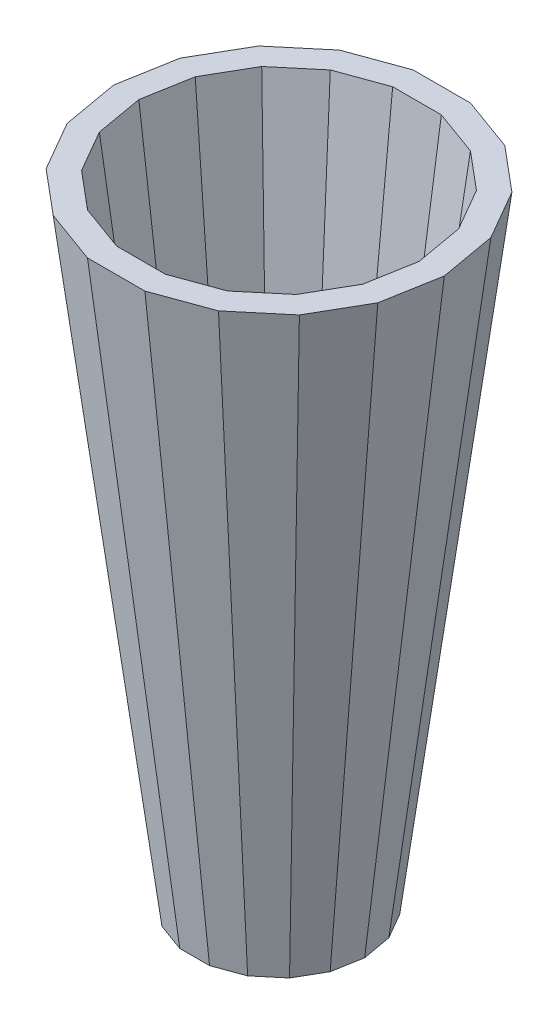
from build123d import *

# Parameters (mm, degrees)
LOFT1_DEPTH        = 508
LOFT1_TAPER        = -7.093868
SHELL1_T           = -19.05
SKETCH5_R          = 147.867108762
CUT_EXTRUDE1_DEPTH = 20
CUT_EXTRUDE2_DEPTH = 526.768458633
CUT_EXTRUDE2_TAPER = -20
CIRPATTERN1_COUNT  = 18


# Read off the part's stored shape, not the designer's step: Loft1
with BuildPart() as part:
    # Loft1 outline → Loft1 (new body)
    with BuildSketch(Plane(origin=(0, -508, 0), x_dir=(1, 0, 0), z_dir=(0, 1, 0))):
        Polygon((31.896938478, -55.24711805), (48.868944947, -41.005913681), (59.946635427, -21.81879094), (63.793876956, 0), (59.946635427, 21.81879094), (48.868944947, 41.005913681), (31.896938478, 55.24711805), (11.07769048, 62.824704621), (-11.07769048, 62.824704621), (-31.896938478, 55.24711805), (-48.868944947, 41.005913681), (-59.946635427, 21.81879094), (-63.793876956, 0), (-59.946635427, -21.81879094), (-48.868944947, -41.005913681), (-31.896938478, -55.24711805), (-11.07769048, -62.824704621), (11.07769048, -62.824704621), align=None)
    extrude(amount=LOFT1_DEPTH, taper=LOFT1_TAPER)

    # Shell1
    shell1_openings = [part.faces().sort_by_distance(p)[0] for p in [
        (0, 0, 0),
    ]]
    offset(amount=SHELL1_T, openings=shell1_openings, kind=Kind.INTERSECTION)

    # Sketch5 → Cut-Extrude1 (cut)
    with BuildSketch(Plane.XZ.offset(508)):
        Circle(SKETCH5_R)
    extrude(amount=-CUT_EXTRUDE1_DEPTH, mode=Mode.SUBTRACT)

    # Sketch6 → Cut-Extrude2 (cut, through all)
    with BuildSketch(Plane(origin=(-57.914835054, -472.553286642, -10.211948003), x_dir=(0.173648177666931, 0, -0.984807753012208), z_dir=(-0.12161910183404463, -0.9923451605496023, -0.021444729022872505))):
        Polygon((-11.516560933, 125.079390032), (-8.131620777, 106.029390032), (8.131620777, 106.029390032), (11.516560933, 125.079390032), align=None)
    cut_extrude2 = extrude(amount=CUT_EXTRUDE2_DEPTH, taper=CUT_EXTRUDE2_TAPER, mode=Mode.SUBTRACT)

    # CirPattern1: Cut-Extrude2 ×18 about axis
    cirpattern1_axis = Axis((0, 0, 0), (0, 1, 0))
    for i in range(1, CIRPATTERN1_COUNT):
        add(cut_extrude2.rotate(cirpattern1_axis, i * 360 / CIRPATTERN1_COUNT), mode=Mode.SUBTRACT)


solid = part.part
